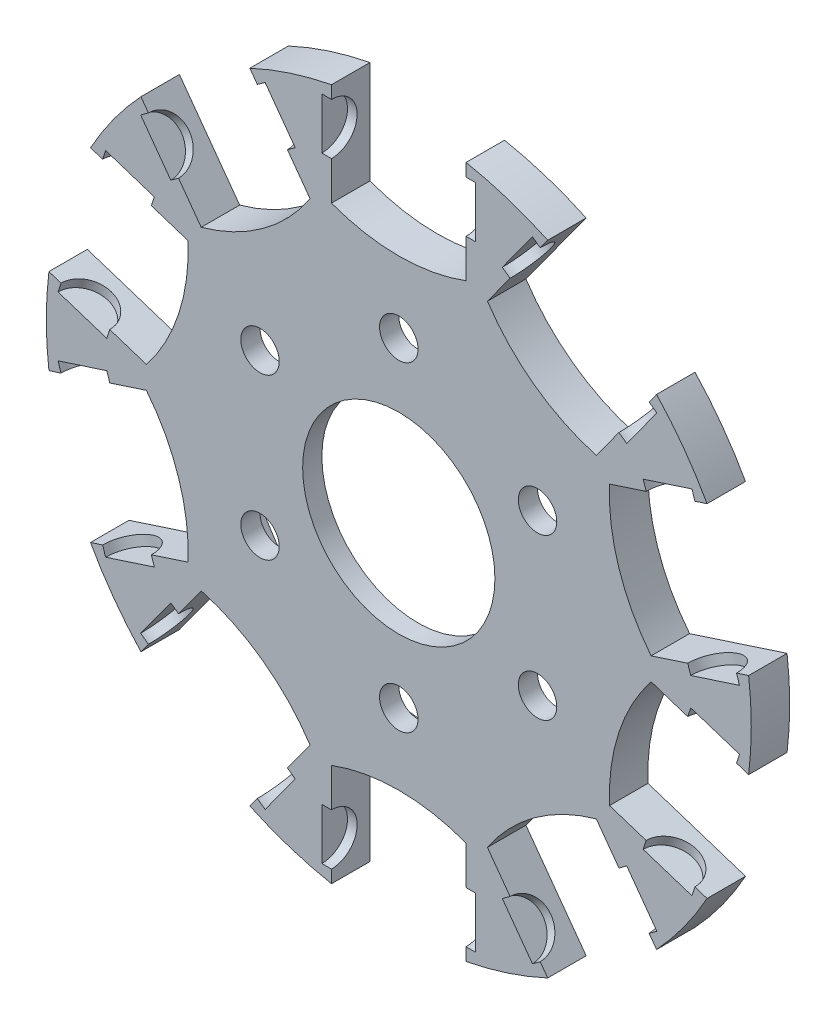
from build123d import *

# Parameters (mm, degrees)
SKETCH2_R           = 1.5
SKETCH2_R_2         = 7.5
BOSS_EXTRUDE2_DEPTH = 3
SKETCH2_4_R         = 15.5
SKETCH2_4_R_2       = 1.5
SKETCH2_4_R_3       = 7.5
BOSS_EXTRUDE3_DEPTH = 3
SKETCH3_W           = 12
SKETCH3_H           = 2
CIRPATTERN1_COUNT   = 10
SKETCH5_R           = 15.5
CUT_EXTRUDE2_DEPTH  = 1.5


with BuildPart() as part:
    # Sketch2 → Boss-Extrude2 (new body)
    with BuildSketch(Plane.XY):
        with BuildLine():
            Line((-5.25, 18.994212343), (-5.25, 26.994212343))
            ThreePointArc((-5.25, 26.994212343), (-8.497967345, 26.154054198), (-11.619460692, 24.92464911))
            Line((-11.619460692, 24.92464911), (-6.917178673, 18.452513155))
            ThreePointArc((-6.917178673, 18.452513155), (-10.606853989, 14.599082063), (-15.411857114, 12.280768005))
            Line((-15.411857114, 12.280768005), (-20.114139133, 18.75290396))
            ThreePointArc((-20.114139133, 18.75290396), (-22.247967345, 16.164094438), (-24.05068233, 13.334717074))
            Line((-24.05068233, 13.334717074), (-16.4422302, 10.862581119))
            ThreePointArc((-16.4422302, 10.862581119), (-17.162250267, 5.576353144), (-19.686908641, 0.876487698))
            Line((-19.686908641, 0.876487698), (-27.295360771, 3.348623653))
            ThreePointArc((-27.295360771, 3.348623653), (-27.5, 0), (-27.295360771, -3.348623653))
            Line((-27.295360771, -3.348623653), (-19.686908641, -0.876487698))
            ThreePointArc((-19.686908641, -0.876487698), (-17.162250267, -5.576353144), (-16.4422302, -10.862581119))
            Line((-16.4422302, -10.862581119), (-24.05068233, -13.334717074))
            ThreePointArc((-24.05068233, -13.334717074), (-22.247967345, -16.164094438), (-20.114139133, -18.75290396))
            Line((-20.114139133, -18.75290396), (-15.411857114, -12.280768005))
            ThreePointArc((-15.411857114, -12.280768005), (-10.606853989, -14.599082063), (-6.917178673, -18.452513155))
            Line((-6.917178673, -18.452513155), (-11.619460692, -24.92464911))
            ThreePointArc((-11.619460692, -24.92464911), (-8.497967345, -26.154054198), (-5.25, -26.994212343))
            Line((-5.25, -26.994212343), (-5.25, -18.994212343))
            ThreePointArc((-5.25, -18.994212343), (0, -18.045457839), (5.25, -18.994212343))
            Line((5.25, -18.994212343), (5.25, -26.994212343))
            ThreePointArc((5.25, -26.994212343), (8.497967345, -26.154054198), (11.619460692, -24.92464911))
            Line((11.619460692, -24.92464911), (6.917178673, -18.452513155))
            ThreePointArc((6.917178673, -18.452513155), (10.606853989, -14.599082063), (15.411857114, -12.280768005))
            Line((15.411857114, -12.280768005), (20.114139133, -18.75290396))
            ThreePointArc((20.114139133, -18.75290396), (22.247967345, -16.164094438), (24.05068233, -13.334717074))
            Line((24.05068233, -13.334717074), (16.4422302, -10.862581119))
            ThreePointArc((16.4422302, -10.862581119), (17.162250267, -5.576353144), (19.686908641, -0.876487698))
            Line((19.686908641, -0.876487698), (27.295360771, -3.348623653))
            ThreePointArc((27.295360771, -3.348623653), (27.5, 0), (27.295360771, 3.348623653))
            Line((27.295360771, 3.348623653), (19.686908641, 0.876487698))
            ThreePointArc((19.686908641, 0.876487698), (17.162250267, 5.576353144), (16.4422302, 10.862581119))
            Line((16.4422302, 10.862581119), (24.05068233, 13.334717074))
            ThreePointArc((24.05068233, 13.334717074), (22.247967345, 16.164094438), (20.114139133, 18.75290396))
            Line((20.114139133, 18.75290396), (15.411857114, 12.280768005))
            ThreePointArc((15.411857114, 12.280768005), (10.606853989, 14.599082063), (6.917178673, 18.452513155))
            Line((6.917178673, 18.452513155), (11.619460692, 24.92464911))
            ThreePointArc((11.619460692, 24.92464911), (8.497967345, 26.154054198), (5.25, 26.994212343))
            Line((5.25, 26.994212343), (5.25, 18.994212343))
            ThreePointArc((5.25, 18.994212343), (0, 18.045457839), (-5.25, 18.994212343))
        make_face()
        with Locations((0, 12.5)):
            Circle(SKETCH2_R, mode=Mode.SUBTRACT)
        with Locations((-10.825317547, -6.25)):
            Circle(SKETCH2_R, mode=Mode.SUBTRACT)
        with Locations((0, -12.5)):
            Circle(SKETCH2_R, mode=Mode.SUBTRACT)
        with Locations((10.825317547, -6.25)):
            Circle(SKETCH2_R, mode=Mode.SUBTRACT)
        with Locations((-10.825317547, 6.25)):
            Circle(SKETCH2_R, mode=Mode.SUBTRACT)
        Circle(SKETCH2_R_2, mode=Mode.SUBTRACT)
        with Locations((10.825317547, 6.25)):
            Circle(SKETCH2_R, mode=Mode.SUBTRACT)
    extrude(amount=BOSS_EXTRUDE2_DEPTH)

    # Sketch2<4> → Boss-Extrude3 (add)
    with BuildSketch(Plane.XY):
        Circle(SKETCH2_4_R)
        with Locations((-10.825317547, -6.25)):
            Circle(SKETCH2_4_R_2, mode=Mode.SUBTRACT)
        with Locations((0, -12.5)):
            Circle(SKETCH2_4_R_2, mode=Mode.SUBTRACT)
        with Locations((10.825317547, -6.25)):
            Circle(SKETCH2_4_R_2, mode=Mode.SUBTRACT)
        with Locations((-10.825317547, 6.25)):
            Circle(SKETCH2_4_R_2, mode=Mode.SUBTRACT)
        Circle(SKETCH2_4_R_3, mode=Mode.SUBTRACT)
        with Locations((10.825317547, 6.25)):
            Circle(SKETCH2_4_R_2, mode=Mode.SUBTRACT)
        with Locations((0, 12.5)):
            Circle(SKETCH2_4_R_2, mode=Mode.SUBTRACT)
    extrude(amount=BOSS_EXTRUDE3_DEPTH)

    # Sketch3 → Cut-Revolve1 (revolve, cut)
    with BuildSketch(Plane.XY.offset(3)):
        with Locations((0, 25)):
            Rectangle(SKETCH3_W, SKETCH3_H)
    cut_revolve1 = revolve(axis=Axis((6, 24, 3), (-1, 0, 0)), mode=Mode.SUBTRACT)

    # CirPattern1: Cut-Revolve1 ×10 about axis
    cirpattern1_axis = Axis((0, 0, 0), (0, 0, 1))
    for i in range(1, CIRPATTERN1_COUNT):
        add(cut_revolve1.rotate(cirpattern1_axis, i * 360 / CIRPATTERN1_COUNT), mode=Mode.SUBTRACT)

    # Sketch5 → Cut-Extrude2 (cut)
    with BuildSketch(Plane(origin=(0, 0, 0), x_dir=(-1, 0, 0), z_dir=(0, 0, -1))):
        Circle(SKETCH5_R)
    extrude(amount=-CUT_EXTRUDE2_DEPTH, mode=Mode.SUBTRACT)


solid = part.part
